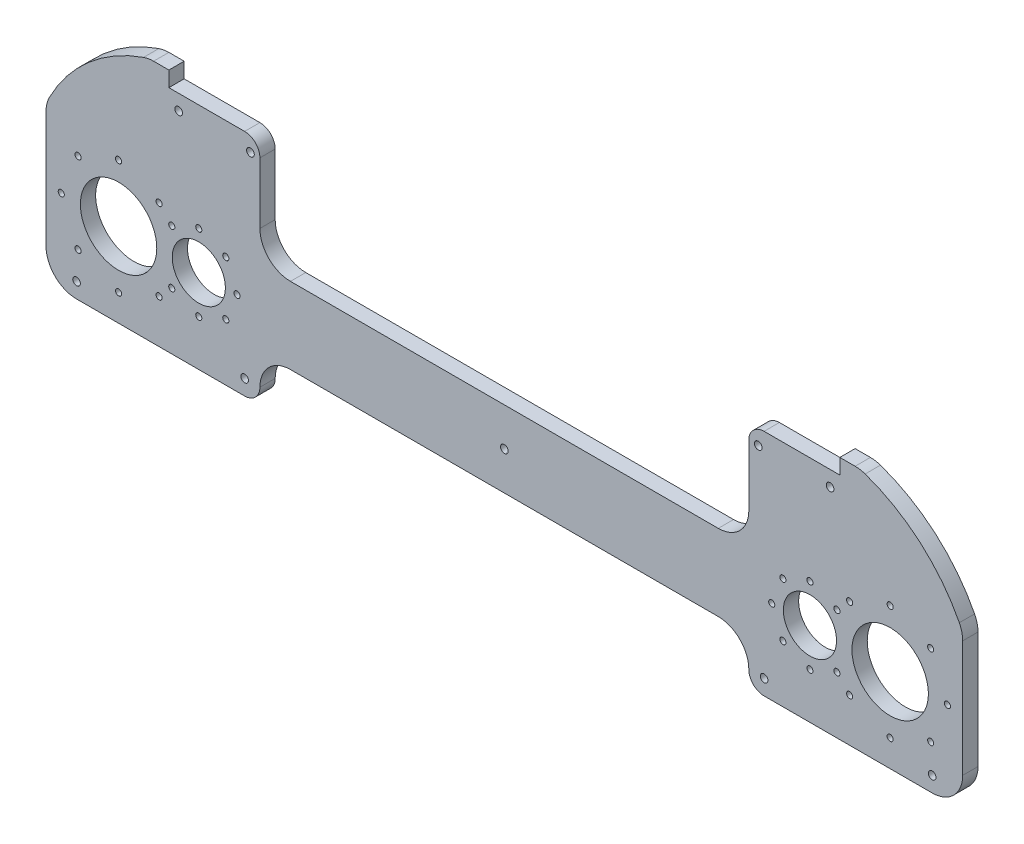
from build123d import *

# Parameters (mm, degrees)
SKETCH1_R           = 3.175
BOSS_EXTRUDE1_DEPTH = 3.175
SKETCH2_R           = 11.049
SKETCH2_R_2         = 15.875
SKETCH2_R_3         = 1.27
CUT_EXTRUDE1_DEPTH  = 202.930998425
ITC_CUTOUT_DEPTH    = 202.930998425
SKETCH6_W           = 67.523241089
SKETCH6_H           = 6.35
CUT_EXTRUDE3_DEPTH  = 202.930998425
FILLET1_R           = 6.35
CUT_EXTRUDE4_DEPTH  = 202.930998425
FILLET2_R           = 6.35
SKETCH8_R           = 1.5875
CUT_EXTRUDE5_DEPTH  = 202.930998425
SKETCH10_R          = 1.5875
CUT_EXTRUDE6_DEPTH  = 202.930998425


with BuildPart() as part:
    # Sketch1 → Boss-Extrude1 (new, symmetric)
    with BuildSketch(Plane.XY):
        with BuildLine():
            Line((-145.783553311, 66.675), (145.783553311, 66.675))
            ThreePointArc((145.783553311, 66.675), (147.900219978, 66.497368874), (149.957676269, 65.969444444))
            ThreePointArc((149.957676269, 65.969444444), (172.789871953, 52.74760778), (189.088888889, 31.999880883))
            ThreePointArc((189.088888889, 31.999880883), (190.142181511, 29.17513943), (190.5, 26.181720723))
            Line((190.5, 26.181720723), (190.5, -22.225))
            ThreePointArc((190.5, -22.225), (186.780256121, -31.205256121), (177.8, -34.925))
            Line((177.8, -34.925), (-177.8, -34.925))
            ThreePointArc((-177.8, -34.925), (-186.780256121, -31.205256121), (-190.5, -22.225))
            Line((-190.5, -22.225), (-190.5, 26.181720723))
            ThreePointArc((-190.5, 26.181720723), (-190.142181511, 29.17513943), (-189.088888889, 31.999880883))
            ThreePointArc((-189.088888889, 31.999880883), (-172.789871953, 52.74760778), (-149.957676269, 65.969444444))
            ThreePointArc((-149.957676269, 65.969444444), (-147.900219978, 66.497368874), (-145.783553311, 66.675))
        make_face()
        with Locations((-127, 0)):
            Circle(SKETCH1_R, mode=Mode.SUBTRACT)
        with Locations((127, 0)):
            Circle(SKETCH1_R, mode=Mode.SUBTRACT)
    extrude(amount=BOSS_EXTRUDE1_DEPTH, both=True)

    # Sketch2 → Cut-Extrude1 (cut, through all)
    with BuildSketch(Plane.XY.offset(3.175)):
        with Locations((-127, 0)):
            Circle(SKETCH2_R)
        with Locations((-160.3375, 0)):
            Circle(SKETCH2_R_2)
        with Locations((-143.499519773, 16.837980227)):
            Circle(SKETCH2_R_3)
        with Locations((-160.3375, 23.8125)):
            Circle(SKETCH2_R_3)
        with Locations((-143.499519773, -16.837980227)):
            Circle(SKETCH2_R_3)
        with Locations((-160.3375, -23.8125)):
            Circle(SKETCH2_R_3)
        with Locations((-177.175480227, -16.837980227)):
            Circle(SKETCH2_R_3)
        with Locations((-184.15, 0)):
            Circle(SKETCH2_R_3)
        with Locations((-177.175480227, 16.837980227)):
            Circle(SKETCH2_R_3)
        with Locations((-127, 15.875)):
            Circle(SKETCH2_R_3)
        with Locations((-115.774679849, 11.225320151)):
            Circle(SKETCH2_R_3)
        with Locations((-111.125, 0)):
            Circle(SKETCH2_R_3)
        with Locations((-115.774679849, -11.225320151)):
            Circle(SKETCH2_R_3)
        with Locations((-127, -15.875)):
            Circle(SKETCH2_R_3)
        with Locations((-138.225320151, -11.225320151)):
            Circle(SKETCH2_R_3)
        with Locations(Location((138.225320151, 11.225320151, 0), (0, 0, 180))):
            Circle(SKETCH2_R_3)
        with Locations((-138.225320151, 11.225320151)):
            Circle(SKETCH2_R_3)
        with Locations(Location((138.225320151, -11.225320151, 0), (0, 0, 180))):
            Circle(SKETCH2_R_3)
        with Locations(Location((127, -15.875, 0), (0, 0, 180))):
            Circle(SKETCH2_R_3)
        with Locations(Location((115.774679849, -11.225320151, 0), (0, 0, 180))):
            Circle(SKETCH2_R_3)
        with Locations(Location((111.125, 0, 0), (0, 0, 180))):
            Circle(SKETCH2_R_3)
        with Locations(Location((115.774679849, 11.225320151, 0), (0, 0, 180))):
            Circle(SKETCH2_R_3)
        with Locations(Location((127, 15.875, 0), (0, 0, 180))):
            Circle(SKETCH2_R_3)
        with Locations(Location((177.175480227, 16.837980227, 0), (0, 0, 180))):
            Circle(SKETCH2_R_3)
        with Locations(Location((184.15, 0, 0), (0, 0, 180))):
            Circle(SKETCH2_R_3)
        with Locations(Location((177.175480227, -16.837980227, 0), (0, 0, 180))):
            Circle(SKETCH2_R_3)
        with Locations(Location((160.3375, -23.8125, 0), (0, 0, 180))):
            Circle(SKETCH2_R_3)
        with Locations(Location((143.499519773, -16.837980227, 0), (0, 0, 180))):
            Circle(SKETCH2_R_3)
        with Locations(Location((160.3375, 23.8125, 0), (0, 0, 180))):
            Circle(SKETCH2_R_3)
        with Locations(Location((143.499519773, 16.837980227, 0), (0, 0, 180))):
            Circle(SKETCH2_R_3)
        with Locations(Location((160.3375, 0, 0), (0, 0, 180))):
            Circle(SKETCH2_R_2)
        with Locations(Location((127, 0, 0), (0, 0, 180))):
            Circle(SKETCH2_R)
    extrude(amount=-CUT_EXTRUDE1_DEPTH, mode=Mode.SUBTRACT)

    # Sketch5 → ITC_Cutout (cut, through all)
    with BuildSketch(Plane.XY.offset(3.175)):
        with BuildLine():
            Line((-88.9, 15.875), (88.9, 15.875))
            ThreePointArc((88.9, 15.875), (97.880256121, 19.594743879), (101.6, 28.575))
            Line((101.6, 28.575), (101.6, 66.675))
            Line((101.6, 66.675), (-101.6, 66.675))
            Line((-101.6, 66.675), (-101.6, 28.575))
            ThreePointArc((-101.6, 28.575), (-97.880256121, 19.594743879), (-88.9, 15.875))
        make_face()
    extrude(amount=-ITC_CUTOUT_DEPTH, mode=Mode.SUBTRACT)

    # Sketch6 → Cut-Extrude3 (cut, through all)
    with BuildSketch(Plane.XY.offset(3.175)):
        with Locations((-105.671932766, 63.5)):
            Rectangle(SKETCH6_W, SKETCH6_H)
        with Locations((105.671932766, 63.5)):
            Rectangle(SKETCH6_W, SKETCH6_H)
    extrude(amount=-CUT_EXTRUDE3_DEPTH, mode=Mode.SUBTRACT)

    # Fillet1
    fillet1_edges = [part.edges().sort_by_distance(p)[0] for p in [
        (-101.6, 60.325, 0),
        (101.6, 60.325, 0),
    ]]
    fillet(fillet1_edges, radius=FILLET1_R)

    # Sketch7 → Cut-Extrude4 (cut, through all)
    with BuildSketch(Plane.XY.offset(3.175)):
        with BuildLine():
            Line((-88.9, -15.875), (88.9, -15.875))
            ThreePointArc((88.9, -15.875), (97.880256121, -19.594743879), (101.6, -28.575))
            Line((101.6, -28.575), (101.6, -34.925))
            Line((101.6, -34.925), (-101.6, -34.925))
            Line((-101.6, -34.925), (-101.6, -28.575))
            ThreePointArc((-101.6, -28.575), (-97.880256121, -19.594743879), (-88.9, -15.875))
        make_face()
    extrude(amount=-CUT_EXTRUDE4_DEPTH, mode=Mode.SUBTRACT)

    # Fillet2
    fillet2_edges = [part.edges().sort_by_distance(p)[0] for p in [
        (101.6, -34.925, 0),
        (-101.6, -34.925, 0),
    ]]
    fillet(fillet2_edges, radius=FILLET2_R - 0.0001)  # a hair under: the kernel refuses the full size

    # Sketch8 → Cut-Extrude5 (cut, through all)
    with BuildSketch(Plane.XY.offset(3.175)):
        with Locations((-135.369553311, 53.975)):
            Circle(SKETCH8_R)
        with Locations((-105.524553311, 53.975)):
            Circle(SKETCH8_R)
        with Locations(Location((105.524553311, 53.975, 0), (0, 0, 180))):
            Circle(SKETCH8_R)
        with Locations(Location((135.369553311, 53.975, 0), (0, 0, 180))):
            Circle(SKETCH8_R)
    extrude(amount=-CUT_EXTRUDE5_DEPTH, mode=Mode.SUBTRACT)

    # Sketch10 → Cut-Extrude6 (cut, through all)
    with BuildSketch(Plane.XY.offset(3.175)):
        with Locations((-177.8, -28.575)):
            Circle(SKETCH10_R)
        with Locations((-107.95, -28.575)):
            Circle(SKETCH10_R)
        with Locations(Location((107.95, -28.575, 0), (0, 0, 180))):
            Circle(SKETCH10_R)
        with Locations(Location((177.8, -28.575, 0), (0, 0, 180))):
            Circle(SKETCH10_R)
        Circle(SKETCH10_R)
    extrude(amount=-CUT_EXTRUDE6_DEPTH, mode=Mode.SUBTRACT)


solid = part.part
